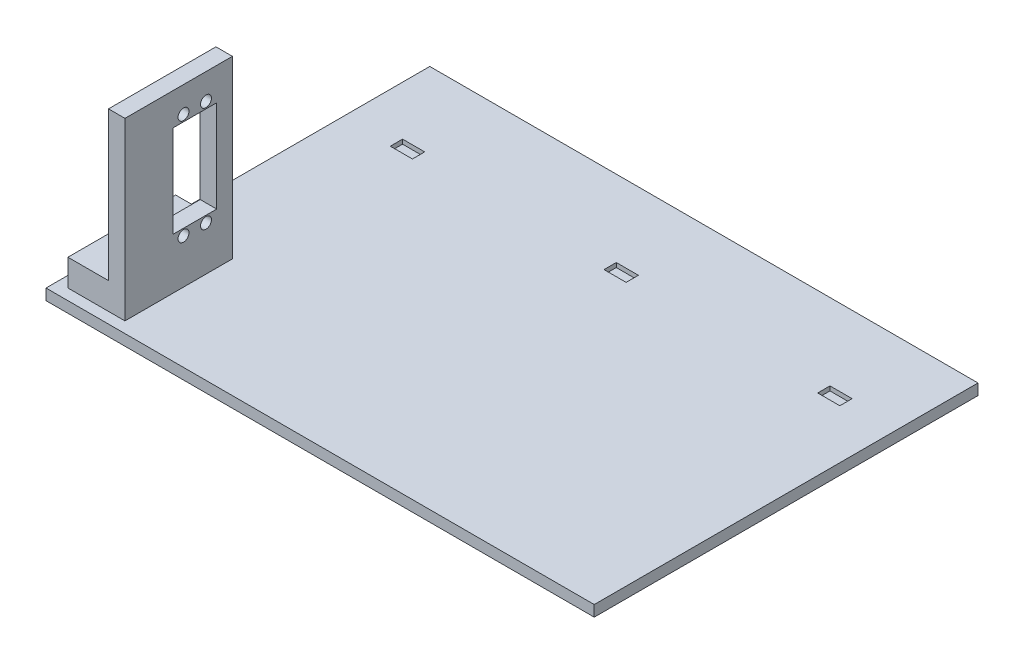
from build123d import *

# Parameters (mm, degrees)
SKETCH1_W               = 250
SKETCH1_H               = 175
BOSS_EXTRUDE1_DEPTH     = 125
SKETCH2_W               = 240
SKETCH2_H               = 165
CUT_EXTRUDE1_DEPTH      = 120
SKETCH3_W               = 40.1
SKETCH3_H               = 165
CUT_EXTRUDE2_DEPTH      = 198.246672976
SKETCH6_W               = 250
SKETCH6_H               = 175
BOSS_EXTRUDE2_DEPTH     = 5
SKETCH7_W               = 205
SKETCH7_H               = 30
PIANO_PLUG_DEPTH        = 5
ARM_HOLE_REACH          = 199.247
SKETCH8_W               = 50
SKETCH8_H               = 180
BOSS_EXTRUDE8_REACH     = 216.001
SKETCH4_R               = 6
MAIN_SHAFT_HOLE_DEPTH   = 293.884362846
CUT_EXTRUDE8_DEPTH      = 16
CUT_EXTRUDE8_DEPTH_BACK = 33
SKETCH10_R              = 20
BOTTOM_OPEN_DEPTH       = 28
BOTTOM_OPEN_DEPTH_BACK  = 21
SKETCH11_W              = 230
SKETCH11_H              = 155
SKETCH12_W              = 41.033462292
SKETCH12_H              = 5
BOSS_EXTRUDE4_DEPTH     = 233
SKETCH13_W              = 7.5
SKETCH13_H              = 80
BOSS_EXTRUDE5_DEPTH     = 49
SKETCH14_W              = 44.113211518
SKETCH14_H              = 5
BOSS_EXTRUDE6_DEPTH     = 21
FILLET2_R               = 5
SKETCH16_R              = 2.5
SKETCH16_W              = 20
SKETCH16_H              = 42
SERVO_PLUG_HOLE_DEPTH   = 106
SKETCH17_W              = 49.113211518
SKETCH17_H              = 12.164138601
BOSS_EXTRUDE7_DEPTH     = 23
SKETCH19_W              = 10.1
SKETCH19_H              = 5.6
CUT_EXTRUDE9_DEPTH      = 2
SKETCH21_W              = 10.1
SKETCH21_H              = 1.1
CUT_EXTRUDE10_DEPTH     = 10
SKETCH23_W              = 230
SKETCH23_H              = 113.966537708
MAKE_IT_PANEL1_DEPTH    = 5
SKETCH22_W              = 250
SKETCH22_H              = 175
SKETCH22_W_2            = 240
SKETCH22_H_2            = 165
MAKE_IT_PANEL3_DEPTH    = 120
SKETCH24_W              = 240
SKETCH24_H              = 165
CUT_EXTRUDE11_DEPTH     = 5


with BuildPart() as part:
    # Sketch1 → Boss-Extrude1 (new body)
    with BuildSketch(Plane(origin=(0, 0, 0), x_dir=(1, 0, 0), z_dir=(0, 1, 0))):
        Rectangle(SKETCH1_W, SKETCH1_H)
    extrude(amount=-BOSS_EXTRUDE1_DEPTH)

    # Sketch2 → Cut-Extrude1 (cut)
    with BuildSketch(Plane.XZ.offset(125)):
        Rectangle(SKETCH2_W, SKETCH2_H)
    extrude(amount=-CUT_EXTRUDE1_DEPTH, mode=Mode.SUBTRACT)

    # Sketch3 → Cut-Extrude2 (cut, through all)
    with BuildSketch(Plane(origin=(0, 0, 0), x_dir=(1, 0, 0), z_dir=(0, 1, 0))):
        Rectangle(SKETCH3_W, SKETCH3_H)
    extrude(amount=-CUT_EXTRUDE2_DEPTH, mode=Mode.SUBTRACT)

    # Sketch6 → Boss-Extrude2 (add)
    with BuildSketch(Plane.XZ.offset(125)):
        Rectangle(SKETCH6_W, SKETCH6_H)
    extrude(amount=-BOSS_EXTRUDE2_DEPTH)

    # Sketch7 → Piano Plug (cut)
    with BuildSketch(Plane(origin=(0, 0, -87.5), x_dir=(-1, 0, 0), z_dir=(0, 0, -1))):
        with Locations((0, -105)):
            Rectangle(SKETCH7_W, SKETCH7_H)
    extrude(amount=-PIANO_PLUG_DEPTH, mode=Mode.SUBTRACT)

    # Arm Hole: up to this face of the body (flat: up to its plane)
    arm_hole_end = Plane(part.part.faces().sort_by_distance((0, -120, -2.144615385))[0])
    # Sketch8 → Arm Hole (cut, up to the picked face)
    with BuildSketch(Plane(origin=(0, 0, 0), x_dir=(1, 0, 0), z_dir=(0, 1, 0)), mode=Mode.PRIVATE) as arm_hole_sk1:
        with Locations((-0.05, -2.5)):
            Rectangle(SKETCH8_W, SKETCH8_H)
    arm_hole_tool1 = split(extrude(arm_hole_sk1.sketch, amount=-ARM_HOLE_REACH, mode=Mode.PRIVATE), bisect_by=arm_hole_end, keep=Keep.BOTH, mode=Mode.PRIVATE)
    add(arm_hole_tool1.solids().sort_by(Axis((-0.05, 0, 2.5), (0, -1, 0)))[0], mode=Mode.SUBTRACT)

    # Sketch9 → Boss-Extrude8 (add, up to next)
    with BuildSketch(Plane(origin=(-25.05, 0, 0), x_dir=(0, 0, -1), z_dir=(1, 0, 0)), mode=Mode.PRIVATE) as boss_extrude8_sk1:
        Polygon((87.5, 0), (87.5, -90), (82.5, -90), (82.5, -5), (0, -5), (0, 0), align=None)
    boss_extrude8_tool1 = extrude(boss_extrude8_sk1.sketch, amount=BOSS_EXTRUDE8_REACH, mode=Mode.PRIVATE) - part.part
    add(boss_extrude8_tool1.solids().sort_by_distance((-25.05, -45, -86.244761))[0])

    # Sketch4 → Main Shaft Hole (cut, through all)
    with BuildSketch(Plane.ZY.offset(125)):
        with Locations((0, -62.5)):
            Circle(SKETCH4_R)
    extrude(amount=-MAIN_SHAFT_HOLE_DEPTH, mode=Mode.SUBTRACT)

    # Sketch10 → Cut-Extrude8 (cut, two sides: drawn at the far end of the back side and taken through both)
    with BuildSketch(Plane.ZY.offset(125).offset(-CUT_EXTRUDE8_DEPTH_BACK)):
        with Locations((50.8, -62.5)):
            Circle(SKETCH10_R)
    extrude(amount=CUT_EXTRUDE8_DEPTH + CUT_EXTRUDE8_DEPTH_BACK, mode=Mode.SUBTRACT)

    # Sketch11 → Bottom Open (cut, two sides: drawn at the far end of the back side and taken through both)
    with BuildSketch(Plane(origin=(0, -125, 0), x_dir=(-1, 0, 0), z_dir=(0, -1, 0)).offset(-BOTTOM_OPEN_DEPTH_BACK)):
        Rectangle(SKETCH11_W, SKETCH11_H)
    extrude(amount=BOTTOM_OPEN_DEPTH + BOTTOM_OPEN_DEPTH_BACK, mode=Mode.SUBTRACT)

    # Sketch12 → Boss-Extrude4 (add)
    with BuildSketch(Plane(origin=(-115, 0, 0), x_dir=(0, 0, -1), z_dir=(1, 0, 0))):
        with Locations((56.983268854, -122.5)):
            Rectangle(SKETCH12_W, SKETCH12_H)
    extrude(amount=BOSS_EXTRUDE4_DEPTH)

    # Sketch13 → Boss-Extrude5 (add)
    with BuildSketch(Plane(origin=(0, 0, 82.5), x_dir=(-1, 0, 0), z_dir=(0, 0, -1))):
        with Locations((97.75, -80)):
            Rectangle(SKETCH13_W, SKETCH13_H)
    extrude(amount=BOSS_EXTRUDE5_DEPTH)

    # Sketch14 → Boss-Extrude6 (add)
    with BuildSketch(Plane(origin=(-115, 0, 0), x_dir=(0, 0, -1), z_dir=(1, 0, 0))):
        with Locations((-55.443394241, -122.5)):
            Rectangle(SKETCH14_W, SKETCH14_H)
    extrude(amount=BOSS_EXTRUDE6_DEPTH)

    # Fillet2
    # the kernel refuses this fillet: 5 mm, written as the material it adds along each edge
    with BuildSketch(Plane(origin=(-101.5, -120, 33.5), x_dir=(0, 1, 0), z_dir=(1, 0, 0))) as fillet2_piece_1:
        with BuildLine():
            CenterArc((1.057968965, -5), FILLET2_R, 90, 12.215768954)
            Line((0, -0.113211518), (-0.021159379, -0.015475748))
            ThreePointArc((-0.021159379, -0.015475748), (-0.1, -0.056605759), (-0.1, 0))
            Line((-0.1, 0), (0, 0.1))
            Line((0, 0.1), (1.057968965, 0.1))
            Line((1.057968965, 0.1), (1.057968965, 0))
        make_face()
    extrude(amount=7.5)

    # Sketch16 → Servo Plug Hole (cut)
    with BuildSketch(Plane(origin=(0, 0, 0), x_dir=(0, 0, -1), z_dir=(1, 0, 0))):
        with Locations((-45.543439041, -51.74216133)):
            Circle(SKETCH16_R)
        with Locations((-55.793439041, -51.74216133)):
            Circle(SKETCH16_R)
        with Locations((-50.668439041, -75.74216133)):
            Rectangle(SKETCH16_W, SKETCH16_H)
        with Locations((-45.543439041, -99.74216133)):
            Circle(SKETCH16_R)
        with Locations((-55.793439041, -99.74216133)):
            Circle(SKETCH16_R)
    extrude(amount=-SERVO_PLUG_HOLE_DEPTH, mode=Mode.SUBTRACT)

    # Sketch17 → Boss-Extrude7 (add)
    with BuildSketch(Plane.ZY.offset(101.5)):
        with Locations((57.943394241, -113.9179307)):
            Rectangle(SKETCH17_W, SKETCH17_H)
    extrude(amount=BOSS_EXTRUDE7_DEPTH)

    # Sketch19 → Cut-Extrude9 (cut)
    with BuildSketch(Plane(origin=(0, -120, 0), x_dir=(1, 0, 0), z_dir=(0, 1, 0))):
        with Locations((97.45, 49.8)):
            Rectangle(SKETCH19_W, SKETCH19_H)
        with Locations((-97.45, 49.8)):
            Rectangle(SKETCH19_W, SKETCH19_H)
        with Locations((0, 49.8)):
            Rectangle(SKETCH19_W, SKETCH19_H)
    extrude(amount=-CUT_EXTRUDE9_DEPTH, mode=Mode.SUBTRACT)

    # Sketch21 → Cut-Extrude10 (cut)
    with BuildSketch(Plane(origin=(0, 0, -87.5), x_dir=(-1, 0, 0), z_dir=(0, 0, -1))):
        with Locations((-97.45, -124)):
            Rectangle(SKETCH21_W, SKETCH21_H)
        with Locations((97.45, -124)):
            Rectangle(SKETCH21_W, SKETCH21_H)
        with Locations((0, -124)):
            Rectangle(SKETCH21_W, SKETCH21_H)
    extrude(amount=-CUT_EXTRUDE10_DEPTH, mode=Mode.SUBTRACT)

    # Sketch23 → Make it Panel1 (add)
    with BuildSketch(Plane(origin=(0, -120, 0), x_dir=(1, 0, 0), z_dir=(0, 1, 0))):
        with Locations((0, -20.516731146)):
            Rectangle(SKETCH23_W, SKETCH23_H)
    extrude(amount=-MAKE_IT_PANEL1_DEPTH)

    # Sketch22 → Make it Panel3 (cut)
    with BuildSketch(Plane(origin=(0, -120, 0), x_dir=(1, 0, 0), z_dir=(0, 1, 0))):
        Rectangle(SKETCH22_W, SKETCH22_H)
        Rectangle(SKETCH22_W_2, SKETCH22_H_2, mode=Mode.SUBTRACT)
    extrude(amount=MAKE_IT_PANEL3_DEPTH, mode=Mode.SUBTRACT)


with BuildPart() as make_it_panel3_piece_1:
    # of the separate pieces the step leaves, piece 1, a body of its own (make_it_panel3_pieces)
    add(part.part.solids().sort_by_distance((-101.5, -118.942031035, 33.5))[0])


with BuildPart() as make_it_panel3_piece_2:
    # of the separate pieces the step leaves, piece 2, a body of its own (make_it_panel3_pieces)
    add(part.part.solids().sort_by_distance((-25.05, -5, 82.5))[0])

    # Sketch24 → Cut-Extrude11 (cut)
    with BuildSketch(Plane(origin=(0, 0, 0), x_dir=(1, 0, 0), z_dir=(0, 1, 0))):
        Rectangle(SKETCH24_W, SKETCH24_H)
    extrude(amount=-CUT_EXTRUDE11_DEPTH, mode=Mode.SUBTRACT)


solid = make_it_panel3_piece_1.part
